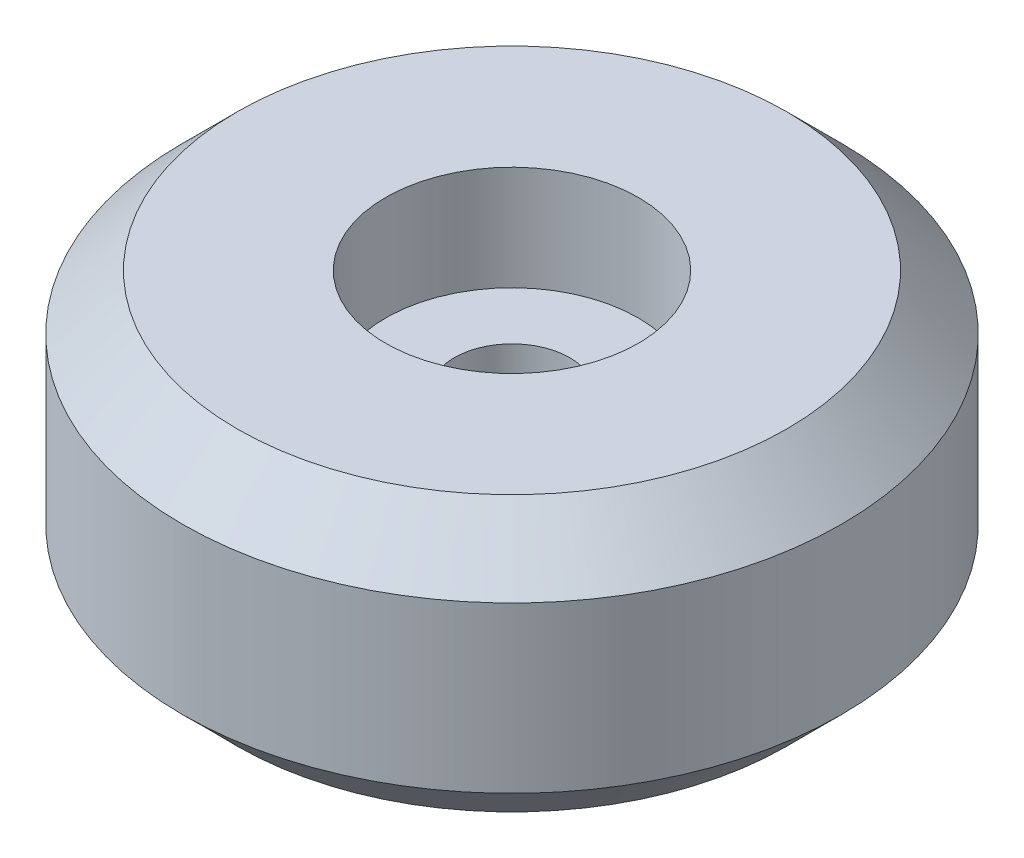
from build123d import *


with BuildPart() as part:
    # Sketch1 → Revolve1 (revolve)
    with BuildSketch(Plane.XY):
        Polygon((4.6, 10.6822398), (10, 10.6822398), (12, 8.6822398), (12, 2.6822398), (10, 0.6822398), (4.6, 0.6822398), (4.6, 4.4822398), (2.1, 4.4822398), (2.1, 6.8822398), (4.6, 6.8822398), align=None)
    revolve(axis=Axis((0, 0, 0), (0, 1, 0)))


solid = part.part
